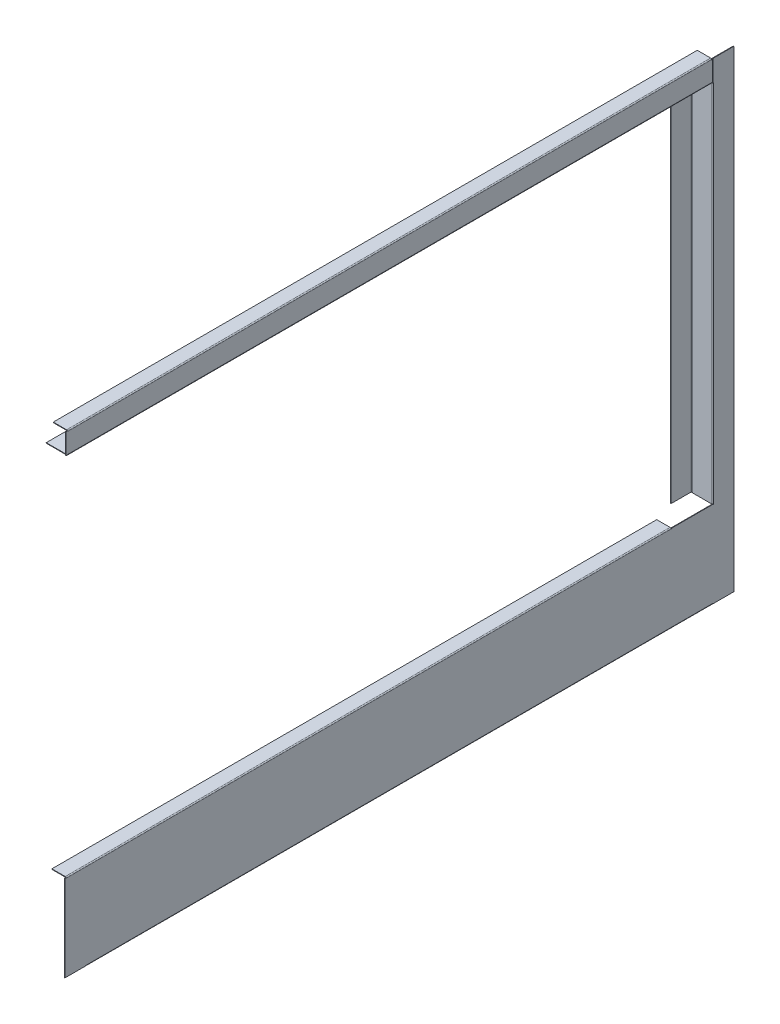
from build123d import *

# Parameters (mm, degrees)
BASE_FLANGE1_DEPTH             = 0.7366
EDGE_FLANGE1_STRIP_W           = 4.4196
EDGE_FLANGE1_STRIP_H           = 0.7366
EDGE_FLANGE1_STRIP_CUT_DEPTH   = 877
EDGE_FLANGE1_RELIEF_W          = 4.7879
EDGE_FLANGE1_RELIEF_H          = 0.3683
EDGE_FLANGE1_RELIEF_CUT_DEPTH  = 0.7366
EDGE_FLANGE1_DEPTH             = 877
EDGE_FLANGE2_START             = 71.2817
EDGE_FLANGE2_DEPTH             = 529.5366
EDGE_FLANGE2_2_DEPTH           = 0.3683
EDGE_FLANGE2_START_2           = 600.45
EDGE_FLANGE2_3_DEPTH           = 0.3683
EDGE_FLANGE2_START_3           = 71.65
EDGE_FLANGE2_4_DEPTH           = 528.8
EDGE_FLANGE3_STRIP_W           = 4.4196
EDGE_FLANGE3_STRIP_H           = 0.7366
EDGE_FLANGE3_STRIP_CUT_DEPTH   = 935.0634
EDGE_FLANGE3_RELIEF_W          = 4.7879
EDGE_FLANGE3_RELIEF_H          = 0.3683
EDGE_FLANGE3_RELIEF_CUT_DEPTH  = 0.7366
EDGE_FLANGE3_DEPTH             = 935.0634
EDGE_FLANGE4_STRIP_W           = 4.4196
EDGE_FLANGE4_STRIP_H           = 0.7366
EDGE_FLANGE4_STRIP_CUT_DEPTH   = 933.8
EDGE_FLANGE4_RELIEF_W          = 4.7879
EDGE_FLANGE4_RELIEF_H          = 0.3683
EDGE_FLANGE4_RELIEF_CUT_DEPTH  = 0.7366
EDGE_FLANGE4_DEPTH             = 933.8
EDGE_FLANGE10_STRIP_W          = 4.4196
EDGE_FLANGE10_STRIP_H          = 0.7366
EDGE_FLANGE10_STRIP_CUT_DEPTH  = 874.5634
EDGE_FLANGE10_RELIEF_W         = 4.7879
EDGE_FLANGE10_RELIEF_H         = 0.3683
EDGE_FLANGE10_RELIEF_CUT_DEPTH = 0.7366
EDGE_FLANGE10_DEPTH            = 874.5634
EDGE_FLANGE11_STRIP_W          = 4.4196
EDGE_FLANGE11_STRIP_H          = 0.7366
EDGE_FLANGE11_STRIP_CUT_DEPTH  = 527.8634
EDGE_FLANGE11_RELIEF_W         = 4.7879
EDGE_FLANGE11_RELIEF_H         = 0.3683
EDGE_FLANGE11_RELIEF_CUT_DEPTH = 0.7366
EDGE_FLANGE11_DEPTH            = 527.8634
EDGE_FLANGE11_START            = 0.7366
EDGE_FLANGE11_PROFILE_W        = 527.9268
EDGE_FLANGE11_PROFILE_H        = 29.4634
EDGE_FLANGE11_FLAT_DEPTH       = 0.7366
EDGE_FLANGE13_STRIP_W          = 4.4196
EDGE_FLANGE13_STRIP_H          = 0.7366
EDGE_FLANGE13_STRIP_CUT_DEPTH  = 909.6
EDGE_FLANGE13_RELIEF_W         = 4.7879
EDGE_FLANGE13_RELIEF_H         = 0.3683
EDGE_FLANGE13_RELIEF_CUT_DEPTH = 0.7366
EDGE_FLANGE13_DEPTH            = 909.6
SKETCH44_W                     = 0.1
SKETCH44_H                     = 30.2
CUT_EXTRUDE16_DEPTH            = 91


with BuildPart() as part:
    # Base-Flange1: sheet metal written as solids
    # Sketch1 → Base-Flange1 (new body)
    with BuildSketch(Plane(origin=(0, 0, 0), x_dir=(0, 0, -1), z_dir=(1, 0, 0))):
        Polygon((-545.14, 71.65), (-545.14, -53.35), (424.86, -53.35), (424.86, 631.65), (-543.14, 631.65), (-543.14, 601.45), (394.86, 601.45), (394.86, 71.65), align=None)
    extrude(amount=-BASE_FLANGE1_DEPTH)

    # Edge-Flange1: sheet metal written as solids
    # Edge-Flange1 strip (on a plane across the edge) → Edge-Flange1 strip cut (cut)
    with BuildSketch(Plane(origin=(-0.7366, 71.65, 543.14), x_dir=(0, -1, 0), z_dir=(0, 0, -1))):
        with Locations((-1.4732, -0.3683)):
            Rectangle(EDGE_FLANGE1_STRIP_W, EDGE_FLANGE1_STRIP_H)
    extrude(amount=EDGE_FLANGE1_STRIP_CUT_DEPTH, mode=Mode.SUBTRACT)

    # Edge-Flange1 relief (on the sheet) → Edge-Flange1 relief cut (cut)
    with BuildSketch(Plane(origin=(-0.7366, 70.9134, 543.14), x_dir=(0, -1, 0), z_dir=(-1, 0, 0))):
        with Locations((-2.02565, 0.18415)):
            Rectangle(EDGE_FLANGE1_RELIEF_W, EDGE_FLANGE1_RELIEF_H)
        with Locations((-2.02565, -877.18415)):
            Rectangle(EDGE_FLANGE1_RELIEF_W, EDGE_FLANGE1_RELIEF_H)
    extrude(amount=-EDGE_FLANGE1_RELIEF_CUT_DEPTH, mode=Mode.SUBTRACT)

    # Edge-Flange1 section (on a plane across the edge) → Edge-Flange1 (add)
    with BuildSketch(Plane(origin=(-0.7366, 71.65, 543.14), x_dir=(0, -1, 0), z_dir=(0, 0, -1))):
        with BuildLine():
            Line((-0.7366, 0.7366), (-0.7366, 20))
            Line((-0.7366, 20), (0, 20))
            Line((0, 20), (0, 0.7366))
            ThreePointArc((0, 0.7366), (0.215745145, 0.215745145), (0.7366, 0))
            Line((0.7366, 0), (0.7366, -0.7366))
            ThreePointArc((0.7366, -0.7366), (-0.30510971, -0.30510971), (-0.7366, 0.7366))
        make_face()
    extrude(amount=EDGE_FLANGE1_DEPTH)

    # Edge-Flange2: read off the stored shape, not the designer's step
    # Edge-Flange2 outline → Edge-Flange2 (cut)
    with BuildSketch(Plane(origin=(0, 0, 0), x_dir=(1, 0, 0), z_dir=(0, 1, 0)).offset(EDGE_FLANGE2_START)):
        with BuildLine():
            Line((0, 394.86), (0, 395.5966))
            ThreePointArc((0, 395.5966), (-0.050198073, 395.215307783), (-0.197371375, 394.86))
            Line((-0.197371375, 394.86), (0, 394.86))
        make_face()
    extrude(amount=EDGE_FLANGE2_DEPTH, mode=Mode.SUBTRACT)

    # Edge-Flange2 2 outline → Edge-Flange2 2 (cut)
    with BuildSketch(Plane(origin=(0, 0, 0), x_dir=(1, 0, 0), z_dir=(0, 1, 0)).offset(EDGE_FLANGE2_START)):
        with BuildLine():
            Line((0, 395.5966), (0, 395.9649))
            Line((0, 395.9649), (-0.7366, 395.9649))
            Line((-0.7366, 395.9649), (-0.7366, 394.86))
            Line((-0.7366, 394.86), (-0.197371375, 394.86))
            ThreePointArc((-0.197371375, 394.86), (-0.050198073, 395.215307783), (0, 395.5966))
        make_face()
    extrude(amount=EDGE_FLANGE2_2_DEPTH, mode=Mode.SUBTRACT)

    # Edge-Flange2 3 outline → Edge-Flange2 3 (cut)
    with BuildSketch(Plane(origin=(0, 0, 0), x_dir=(1, 0, 0), z_dir=(0, 1, 0)).offset(EDGE_FLANGE2_START_2)):
        with BuildLine():
            Line((0, 395.5966), (0, 395.9649))
            Line((0, 395.9649), (-0.7366, 395.9649))
            Line((-0.7366, 395.9649), (-0.7366, 394.86))
            Line((-0.7366, 394.86), (-0.197371375, 394.86))
            ThreePointArc((-0.197371375, 394.86), (-0.050198073, 395.215307783), (0, 395.5966))
        make_face()
    extrude(amount=EDGE_FLANGE2_3_DEPTH, mode=Mode.SUBTRACT)

    # Edge-Flange2 4 outline → Edge-Flange2 4 (add)
    with BuildSketch(Plane(origin=(0, 0, 0), x_dir=(1, 0, 0), z_dir=(0, 1, 0)).offset(EDGE_FLANGE2_START_3)):
        with BuildLine():
            Line((-0.7366, 394.86), (-0.7366, 395.5966))
            ThreePointArc((-0.7366, 395.5966), (-0.952345145, 395.075745145), (-1.4732, 394.86))
            Line((-1.4732, 394.86), (-30.2, 394.86))
            Line((-30.2, 394.86), (-30.2, 394.1234))
            Line((-30.2, 394.1234), (-1.4732, 394.1234))
            ThreePointArc((-1.4732, 394.1234), (-0.7366, 394.320771375), (-0.197371375, 394.86))
            Line((-0.197371375, 394.86), (-0.7366, 394.86))
        make_face()
    extrude(amount=EDGE_FLANGE2_4_DEPTH)

    # Edge-Flange3: sheet metal written as solids
    # Edge-Flange3 strip (on a plane across the edge) → Edge-Flange3 strip cut (cut)
    with BuildSketch(Plane(origin=(-0.7366, 601.45, -393.9234), x_dir=(0, 1, 0), z_dir=(0, 0, 1))):
        with Locations((-1.4732, -0.3683)):
            Rectangle(EDGE_FLANGE3_STRIP_W, EDGE_FLANGE3_STRIP_H)
    extrude(amount=EDGE_FLANGE3_STRIP_CUT_DEPTH, mode=Mode.SUBTRACT)

    # Edge-Flange3 relief (on the sheet) → Edge-Flange3 relief cut (cut)
    with BuildSketch(Plane(origin=(-0.7366, 602.1866, -393.9234), x_dir=(0, 1, 0), z_dir=(-1, 0, 0))):
        with Locations((-2.02565, 0.18415)):
            Rectangle(EDGE_FLANGE3_RELIEF_W, EDGE_FLANGE3_RELIEF_H)
        with Locations((-2.02565, -935.24755)):
            Rectangle(EDGE_FLANGE3_RELIEF_W, EDGE_FLANGE3_RELIEF_H)
    extrude(amount=-EDGE_FLANGE3_RELIEF_CUT_DEPTH, mode=Mode.SUBTRACT)

    # Edge-Flange3 section (on a plane across the edge) → Edge-Flange3 (add)
    with BuildSketch(Plane(origin=(-0.7366, 601.45, -393.9234), x_dir=(0, 1, 0), z_dir=(0, 0, 1))):
        with BuildLine():
            Line((-0.7366, 0.7366), (-0.7366, 30.2))
            Line((-0.7366, 30.2), (0, 30.2))
            Line((0, 30.2), (0, 0.7366))
            ThreePointArc((0, 0.7366), (0.215745145, 0.215745145), (0.7366, 0))
            Line((0.7366, 0), (0.7366, -0.7366))
            ThreePointArc((0.7366, -0.7366), (-0.30510971, -0.30510971), (-0.7366, 0.7366))
        make_face()
    extrude(amount=EDGE_FLANGE3_DEPTH)

    # Edge-Flange4: sheet metal written as solids
    # Edge-Flange4 strip (on a plane across the edge) → Edge-Flange4 strip cut (cut)
    with BuildSketch(Plane(origin=(-0.7366, 631.65, 541.14), x_dir=(0, -1, 0), z_dir=(0, 0, -1))):
        with Locations((-1.4732, -0.3683)):
            Rectangle(EDGE_FLANGE4_STRIP_W, EDGE_FLANGE4_STRIP_H)
    extrude(amount=EDGE_FLANGE4_STRIP_CUT_DEPTH, mode=Mode.SUBTRACT)

    # Edge-Flange4 relief (on the sheet) → Edge-Flange4 relief cut (cut)
    with BuildSketch(Plane(origin=(-0.7366, 630.9134, 541.14), x_dir=(0, -1, 0), z_dir=(-1, 0, 0))):
        with Locations((-2.02565, 0.18415)):
            Rectangle(EDGE_FLANGE4_RELIEF_W, EDGE_FLANGE4_RELIEF_H)
        with Locations((-2.02565, -933.98415)):
            Rectangle(EDGE_FLANGE4_RELIEF_W, EDGE_FLANGE4_RELIEF_H)
    extrude(amount=-EDGE_FLANGE4_RELIEF_CUT_DEPTH, mode=Mode.SUBTRACT)

    # Edge-Flange4 section (on a plane across the edge) → Edge-Flange4 (add)
    with BuildSketch(Plane(origin=(-0.7366, 631.65, 541.14), x_dir=(0, -1, 0), z_dir=(0, 0, -1))):
        with BuildLine():
            Line((-0.7366, 0.7366), (-0.7366, 20))
            Line((-0.7366, 20), (0, 20))
            Line((0, 20), (0, 0.7366))
            ThreePointArc((0, 0.7366), (0.215745145, 0.215745145), (0.7366, 0))
            Line((0.7366, 0), (0.7366, -0.7366))
            ThreePointArc((0.7366, -0.7366), (-0.30510971, -0.30510971), (-0.7366, 0.7366))
        make_face()
    extrude(amount=EDGE_FLANGE4_DEPTH)

    # Edge-Flange10: sheet metal written as solids
    # Edge-Flange10 strip (on a plane across the edge) → Edge-Flange10 strip cut (cut)
    with BuildSketch(Plane(origin=(-30.9366, 600.7134, 510.84), x_dir=(1, 0, 0), z_dir=(0, 0, -1))):
        with Locations((-1.4732, -0.3683)):
            Rectangle(EDGE_FLANGE10_STRIP_W, EDGE_FLANGE10_STRIP_H)
    extrude(amount=EDGE_FLANGE10_STRIP_CUT_DEPTH, mode=Mode.SUBTRACT)

    # Edge-Flange10 relief (on the sheet) → Edge-Flange10 relief cut (cut)
    with BuildSketch(Plane(origin=(-30.2, 600.7134, 510.84), x_dir=(1, 0, 0), z_dir=(0, -1, 0))):
        with Locations((-2.02565, 0.18415)):
            Rectangle(EDGE_FLANGE10_RELIEF_W, EDGE_FLANGE10_RELIEF_H)
        with Locations((-2.02565, -874.74755)):
            Rectangle(EDGE_FLANGE10_RELIEF_W, EDGE_FLANGE10_RELIEF_H)
    extrude(amount=-EDGE_FLANGE10_RELIEF_CUT_DEPTH, mode=Mode.SUBTRACT)

    # Edge-Flange10 section (on a plane across the edge) → Edge-Flange10 (add)
    with BuildSketch(Plane(origin=(-30.9366, 600.7134, 510.84), x_dir=(1, 0, 0), z_dir=(0, 0, -1))):
        with BuildLine():
            Line((-0.7366, 0.7366), (-0.7366, 30.2))
            Line((-0.7366, 30.2), (0, 30.2))
            Line((0, 30.2), (0, 0.7366))
            ThreePointArc((0, 0.7366), (0.215745145, 0.215745145), (0.7366, 0))
            Line((0.7366, 0), (0.7366, -0.7366))
            ThreePointArc((0.7366, -0.7366), (-0.30510971, -0.30510971), (-0.7366, 0.7366))
        make_face()
    extrude(amount=EDGE_FLANGE10_DEPTH)

    # Edge-Flange11: sheet metal written as solids
    # Edge-Flange11 strip (on a plane across the edge) → Edge-Flange11 strip cut (cut)
    with BuildSketch(Plane(origin=(-30.2, 600.45, -394.1234), x_dir=(1, 0, 0), z_dir=(0, -1, 0))):
        with Locations((-1.4732, -0.3683)):
            Rectangle(EDGE_FLANGE11_STRIP_W, EDGE_FLANGE11_STRIP_H)
    extrude(amount=EDGE_FLANGE11_STRIP_CUT_DEPTH, mode=Mode.SUBTRACT)

    # Edge-Flange11 relief (on the sheet) → Edge-Flange11 relief cut (cut)
    with BuildSketch(Plane(origin=(-29.4634, 600.45, -394.1234), x_dir=(1, 0, 0), z_dir=(0, 0, 1))):
        with Locations((-2.02565, -528.04755)):
            Rectangle(EDGE_FLANGE11_RELIEF_W, EDGE_FLANGE11_RELIEF_H)
    extrude(amount=-EDGE_FLANGE11_RELIEF_CUT_DEPTH, mode=Mode.SUBTRACT)

    # Edge-Flange11 bend section (on a plane across the edge) → Edge-Flange11 (add)
    with BuildSketch(Plane(origin=(-30.2, 600.45, -394.1234), x_dir=(1, 0, 0), z_dir=(0, -1, 0))):
        with BuildLine():
            Line((-0.7366, 0.7366), (0, 0.7366))
            ThreePointArc((0, 0.7366), (0.215745145, 0.215745145), (0.7366, 0))
            Line((0.7366, 0), (0.7366, -0.7366))
            ThreePointArc((0.7366, -0.7366), (-0.30510971, -0.30510971), (-0.7366, 0.7366))
        make_face()
    extrude(amount=EDGE_FLANGE11_DEPTH)

    # Edge-Flange11 profile (on flange) → Edge-Flange11 flat (add)
    with BuildSketch(Plane(origin=(-30.2, 0, -394.1234), x_dir=(0, -1, 0), z_dir=(-1, 0, 0)).offset(EDGE_FLANGE11_START)):
        with Locations((-336.55, 15.4683)):
            Rectangle(EDGE_FLANGE11_PROFILE_W, EDGE_FLANGE11_PROFILE_H)
    extrude(amount=-EDGE_FLANGE11_FLAT_DEPTH)

    # Edge-Flange13: sheet metal written as solids
    # Edge-Flange13 strip (on a plane across the edge) → Edge-Flange13 strip cut (cut)
    with BuildSketch(Plane(origin=(-0.7366, -53.35, -394.66), x_dir=(0, 1, 0), z_dir=(0, 0, 1))):
        with Locations((-1.4732, -0.3683)):
            Rectangle(EDGE_FLANGE13_STRIP_W, EDGE_FLANGE13_STRIP_H)
    extrude(amount=EDGE_FLANGE13_STRIP_CUT_DEPTH, mode=Mode.SUBTRACT)

    # Edge-Flange13 relief (on the sheet) → Edge-Flange13 relief cut (cut)
    with BuildSketch(Plane(origin=(-0.7366, -52.6134, -394.66), x_dir=(0, 1, 0), z_dir=(-1, 0, 0))):
        with Locations((-2.02565, 0.18415)):
            Rectangle(EDGE_FLANGE13_RELIEF_W, EDGE_FLANGE13_RELIEF_H)
        with Locations((-2.02565, -909.78415)):
            Rectangle(EDGE_FLANGE13_RELIEF_W, EDGE_FLANGE13_RELIEF_H)
    extrude(amount=-EDGE_FLANGE13_RELIEF_CUT_DEPTH, mode=Mode.SUBTRACT)

    # Edge-Flange13 section (on a plane across the edge) → Edge-Flange13 (add)
    with BuildSketch(Plane(origin=(-0.7366, -53.35, -394.66), x_dir=(0, 1, 0), z_dir=(0, 0, 1))):
        with BuildLine():
            Line((-0.7366, 0.7366), (-0.7366, 30))
            Line((-0.7366, 30), (0, 30))
            Line((0, 30), (0, 0.7366))
            ThreePointArc((0, 0.7366), (0.215745145, 0.215745145), (0.7366, 0))
            Line((0.7366, 0), (0.7366, -0.7366))
            ThreePointArc((0.7366, -0.7366), (-0.30510971, -0.30510971), (-0.7366, 0.7366))
        make_face()
    extrude(amount=EDGE_FLANGE13_DEPTH)

    # Sketch44 → Cut-Extrude16 (cut)
    with BuildSketch(Plane.ZY.offset(0.7366)):
        with Locations((-394.3417, 616.55)):
            Rectangle(SKETCH44_W, SKETCH44_H)
    extrude(amount=-CUT_EXTRUDE16_DEPTH, mode=Mode.SUBTRACT)


with BuildPart() as cut_extrude16_piece_1:
    # of the separate pieces the step leaves, piece 1, a body of its own (cut_extrude16_pieces)
    add(part.part.solids().sort_by_distance((0, 71.65, 545.14))[0])


with BuildPart() as cut_extrude16_piece_2:
    # of the separate pieces the step leaves, piece 2, a body of its own (cut_extrude16_pieces)
    add(part.part.solids().sort_by_distance((0, 602.5549, -393.9234))[0])


solid = Compound([cut_extrude16_piece_1.part, cut_extrude16_piece_2.part])
